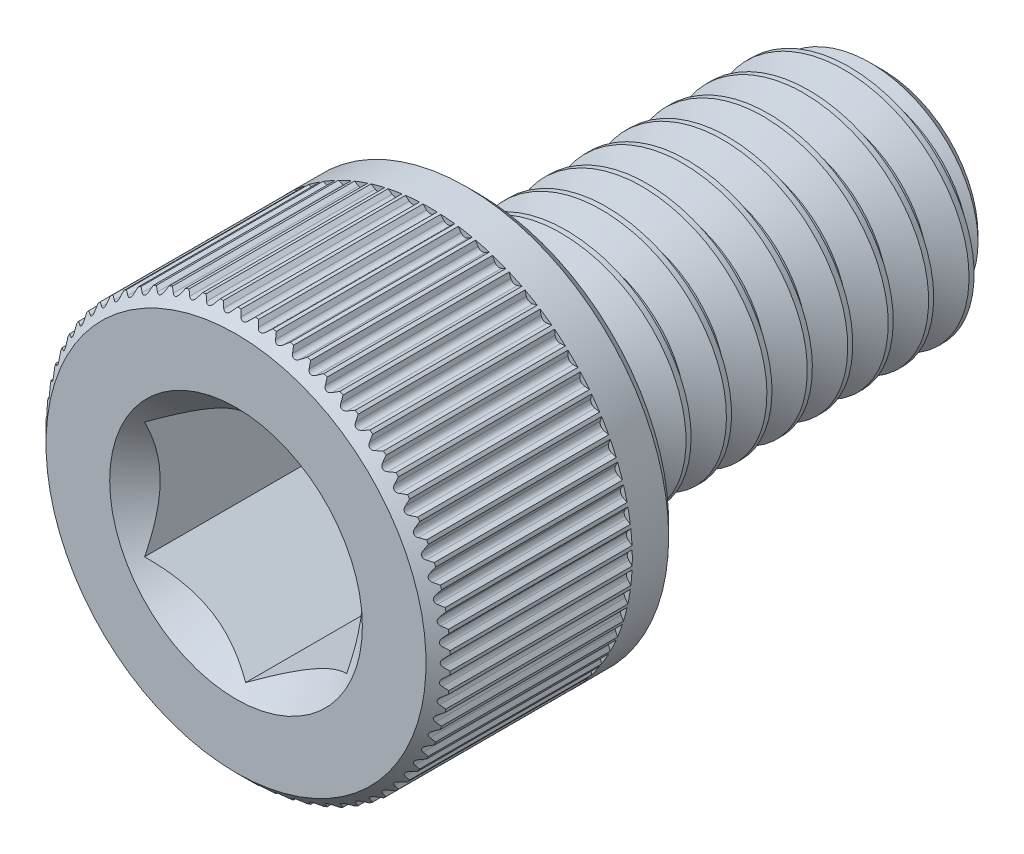
from build123d import *

# Parameters (mm, degrees)
CUT_EXTRUDE1_DEPTH     = 5
SKETCH4_R              = 3.125
CUT_EXTRUDE2_DEPTH     = 3
CUT_EXTRUDE2_DRAFT     = -45
SPLIT1_SURFACE_1_BACK  = 22.354
SPLIT1_SURFACE_1_DEPTH = 44.708
SPLIT1_SURFACE_2_BACK  = 22.354
SPLIT1_SURFACE_2_DEPTH = 44.708
CUT_SWEEP1_PITCH       = 1
CUT_EXTRUDE3_DEPTH     = 4.8
CIRPATTERN1_COUNT      = 72


with BuildPart() as part:
    # Sketch2 → Revolve1 (revolve)
    with BuildSketch(Plane(origin=(0, 0, 0), x_dir=(0, 0, -1), z_dir=(1, 0, 0))):
        with BuildLine():
            Line((-8, 0), (-8, 4.7))
            Line((-8, 4.7), (-7.7, 5))
            Line((-7.7, 5), (-2.3, 5))
            Line((-2.3, 5), (-2, 4.7))
            Line((-2, 4.7), (-2, 3.3))
            ThreePointArc((-2, 3.3), (-1.912132034, 3.087867966), (-1.7, 3))
            Line((-1.7, 3), (7.350480947, 3))
            Line((7.350480947, 3), (8, 2.350480947))
            Line((8, 2.350480947), (8, 0))
            Line((8, 0), (-8, 0))
        make_face()
    revolve(axis=Axis((0, 0, -8), (0, 0, 1)))

    # Sketch3 → Cut-Extrude1 (cut)
    with BuildSketch(Plane.XY.offset(8)):
        Polygon((2.5, -1.443375673), (2.5, 1.443375673), (0, 2.886751346), (-2.5, 1.443375673), (-2.5, -1.443375673), (0, -2.886751346), align=None)
    extrude(amount=-CUT_EXTRUDE1_DEPTH, mode=Mode.SUBTRACT)


with BuildPart() as cut_extrude2_tool:
    # Sketch4 → Cut-Extrude2 (with draft: the straight prism first)
    with BuildSketch(Plane.XY.offset(8)):
        Circle(SKETCH4_R)
    extrude(amount=-CUT_EXTRUDE2_DEPTH)
    # Cut-Extrude2: the draft: its side faces are tilted about the plane it starts from
    cut_extrude2_sides = [cut_extrude2_tool.faces().sort_by_distance(p)[0] for p in [
        (-3.125, 0, 6.5),
    ]]
    draft(cut_extrude2_sides, Plane.XY.offset(8), CUT_EXTRUDE2_DRAFT)


with BuildPart() as part_1:
    add(part.part)

    # Cut-Extrude2: cut by cut_extrude2_tool
    add(cut_extrude2_tool.part, mode=Mode.SUBTRACT)


with BuildPart() as body_2:
    # Split1: the piece behind the surface
    add(part_1.part)
    # Split1 surface: a surface, the sketch's curves swept straight by 44.708 mm
    with BuildLine(Plane(origin=(0, 0, 0), x_dir=(0, 0, -1), z_dir=(1, 0, 0)).offset(-SPLIT1_SURFACE_1_BACK), mode=Mode.PRIVATE) as split1_surface_1_path:
        Line((-1.7, -5), (-1.7, 5))
    split1_surface_1 = Shell.extrude(split1_surface_1_path.wire(), (1 * SPLIT1_SURFACE_1_DEPTH, 0 * SPLIT1_SURFACE_1_DEPTH, 0 * SPLIT1_SURFACE_1_DEPTH))
    split(bisect_by=split1_surface_1, keep=Keep.BOTTOM)

    # Cut-Sweep1: the profile of Sketch7 screwed along a right-hand helix of 11 turns, 8 arcs to a turn; built about Z, then put on its axis
    cut_sweep1_z = Axis((0, 0, 0), (0, 0, 1))
    cut_sweep1_corners = [(3.054126588, 0, 0.03125), (3.054126588, 0, -0.90625), (2.350480947, 0, -0.5), (2.350480947, 0, -0.375)]
    with BuildLine(mode=Mode.PRIVATE) as cut_sweep1_profile:
        Line(cut_sweep1_corners[0], cut_sweep1_corners[1])
        Line(cut_sweep1_corners[1], cut_sweep1_corners[2])
        Line(cut_sweep1_corners[2], cut_sweep1_corners[3])
        Line(cut_sweep1_corners[3], cut_sweep1_corners[0])
    cut_sweep1_cap = Face(cut_sweep1_profile.wire())
    cut_sweep1_turn_angles = [0, 22.5, 45, 67.5, 90, 112.5, 135, 157.5, 180, 202.5, 225, 247.5, 270, 292.5, 315, 337.5, 360]
    cut_sweep1_turn_weights = [1, 0.9238795325112867, 1, 0.9238795325112867, 1, 0.9238795325112867, 1, 0.9238795325112867, 1, 0.9238795325112867, 1, 0.9238795325112867, 1, 0.9238795325112867, 1, 0.9238795325112867, 1]
    cut_sweep1_turn_rails = [Edge.make_bspline([Vector(p[0], p[1], 0).rotate(cut_sweep1_z, cut_sweep1_turn_angles[k]) / cut_sweep1_turn_weights[k] + Vector(0, 0, p[2] + CUT_SWEEP1_PITCH * cut_sweep1_turn_angles[k] / 360) for k in range(17)], [0, 0, 0, 1, 1, 2, 2, 3, 3, 4, 4, 5, 5, 6, 6, 7, 7, 8, 8, 8], 2, cut_sweep1_turn_weights) for p in cut_sweep1_corners]
    cut_sweep1_turn_sides = [Face.make_surface_from_curves(cut_sweep1_turn_rails[p[0]], cut_sweep1_turn_rails[p[1]]) for p in [(0, 1), (1, 2), (2, 3), (3, 0)]]
    cut_sweep1 = Plane(origin=(0, 0, -8), x_dir=(0, 1, 0), z_dir=(0, 0, 1)) * Solid(Shell([*[p.moved(Location((0, 0, CUT_SWEEP1_PITCH * i))) for i in range(11) for p in cut_sweep1_turn_sides], cut_sweep1_cap, cut_sweep1_cap.rotate(cut_sweep1_z, 3960).moved(Location((0, 0, CUT_SWEEP1_PITCH * 3960 / 360)))]))
    add(cut_sweep1, mode=Mode.SUBTRACT)


with BuildPart() as part_2:
    add(part_1.part)

    # Split1: split by a surface, the side it looks to stays
    # Split1 surface: a surface, the sketch's curves swept straight by 44.708 mm
    with BuildLine(Plane(origin=(0, 0, 0), x_dir=(0, 0, -1), z_dir=(1, 0, 0)).offset(-SPLIT1_SURFACE_2_BACK), mode=Mode.PRIVATE) as split1_surface_2_path:
        Line((-1.7, -5), (-1.7, 5))
    split1_surface_2 = Shell.extrude(split1_surface_2_path.wire(), (1 * SPLIT1_SURFACE_2_DEPTH, 0 * SPLIT1_SURFACE_2_DEPTH, 0 * SPLIT1_SURFACE_2_DEPTH))
    split(bisect_by=split1_surface_2, keep=Keep.TOP)

    add(body_2.part)  # Revolve2 merges body 2
    # Sketch8 → Revolve2 (revolve)
    with BuildSketch(Plane(origin=(0, 0, 0), x_dir=(0, 0, -1), z_dir=(1, 0, 0))):
        Polygon((-2, 0), (-2, 3), (-1.7, 3), (0.032050808, 0), align=None)
    revolve(axis=Axis((0, 0, -0.032050808), (0, 0, 1)))

    # Sketch12 → Cut-Extrude3 (cut)
    with BuildSketch(Plane.XY.offset(8)):
        with BuildLine():
            Line((-0.302543348, 5.125), (0.302543348, 5.125))
            Line((0.302543348, 5.125), (0.089697106, 4.912153758))
            ThreePointArc((0.089697106, 4.912153758), (0, 4.875), (-0.089697106, 4.912153758))
            Line((-0.089697106, 4.912153758), (-0.302543348, 5.125))
        make_face()
    cut_extrude3 = extrude(amount=-CUT_EXTRUDE3_DEPTH, mode=Mode.SUBTRACT)

    # CirPattern1: Cut-Extrude3 ×72 about axis
    cirpattern1_axis = Axis((0, 0, 0), (0, 0, 1))
    for i in range(1, CIRPATTERN1_COUNT):
        add(cut_extrude3.rotate(cirpattern1_axis, i * 360 / CIRPATTERN1_COUNT), mode=Mode.SUBTRACT)


solid = part_2.part
